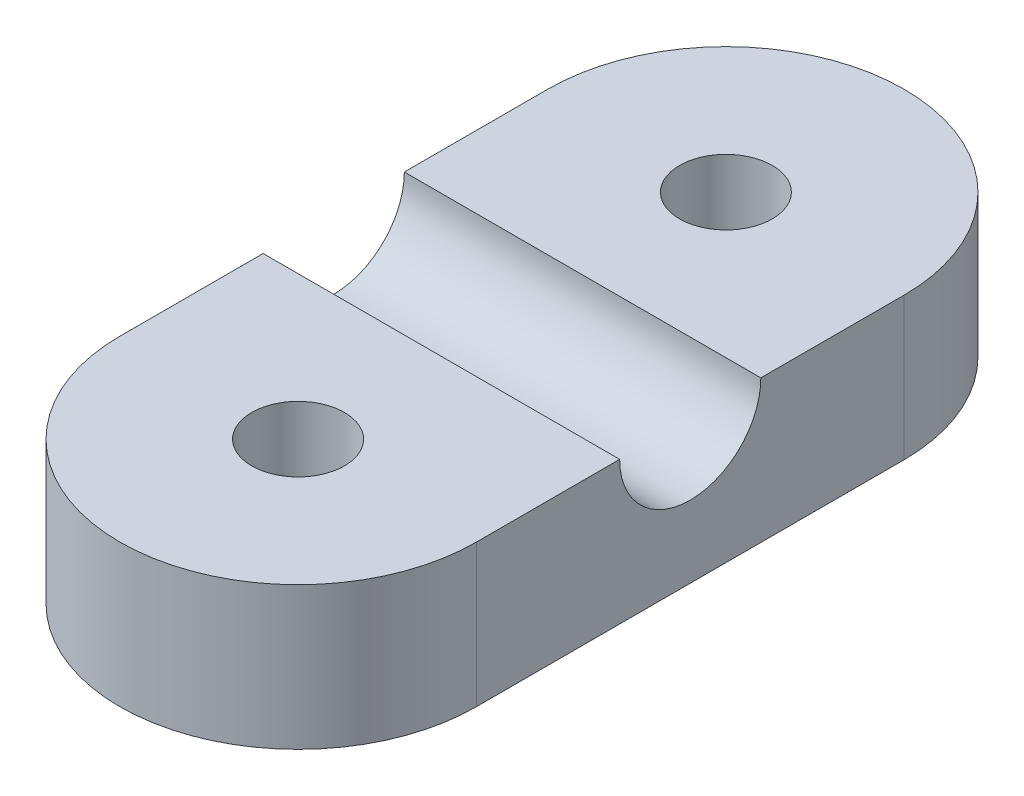
from build123d import *

# Parameters (mm, degrees)
SKETCH1_R           = 3.25
BOSS_EXTRUDE1_DEPTH = 10
CUT_EXTRUDE1_REACH  = 40.487
SKETCH2_R           = 4.95


with BuildPart() as part:
    # Sketch1 → Boss-Extrude1 (new body)
    with BuildSketch(Plane(origin=(0, 0, 0), x_dir=(1, 0, 0), z_dir=(0, 1, 0))):
        with BuildLine():
            ThreePointArc((12.5, 15), (0, 27.5), (-12.5, 15))
            Line((-12.5, 15), (-12.5, -14.999999966))
            ThreePointArc((-12.5, -14.999999966), (-1.7e-08, -27.5), (12.5, -15))
            Line((12.5, -15), (12.5, 15))
        make_face()
        with Locations((0, 15)):
            Circle(SKETCH1_R, mode=Mode.SUBTRACT)
        with Locations((0, -15)):
            Circle(SKETCH1_R, mode=Mode.SUBTRACT)
    extrude(amount=BOSS_EXTRUDE1_DEPTH)

    # Sketch2 → Cut-Extrude1 (cut, up to next)
    with BuildSketch(Plane(origin=(12.5, 0, 0), x_dir=(0, 0, -1), z_dir=(1, 0, 0)), mode=Mode.PRIVATE) as cut_extrude1_sk1:
        with Locations((0, 10)):
            Circle(SKETCH2_R)
    cut_extrude1_tool1 = extrude(cut_extrude1_sk1.sketch, amount=-CUT_EXTRUDE1_REACH, mode=Mode.PRIVATE) & part.part
    add(cut_extrude1_tool1.solids().sort_by_distance((12.5, 10, 0))[0], mode=Mode.SUBTRACT)


solid = part.part
